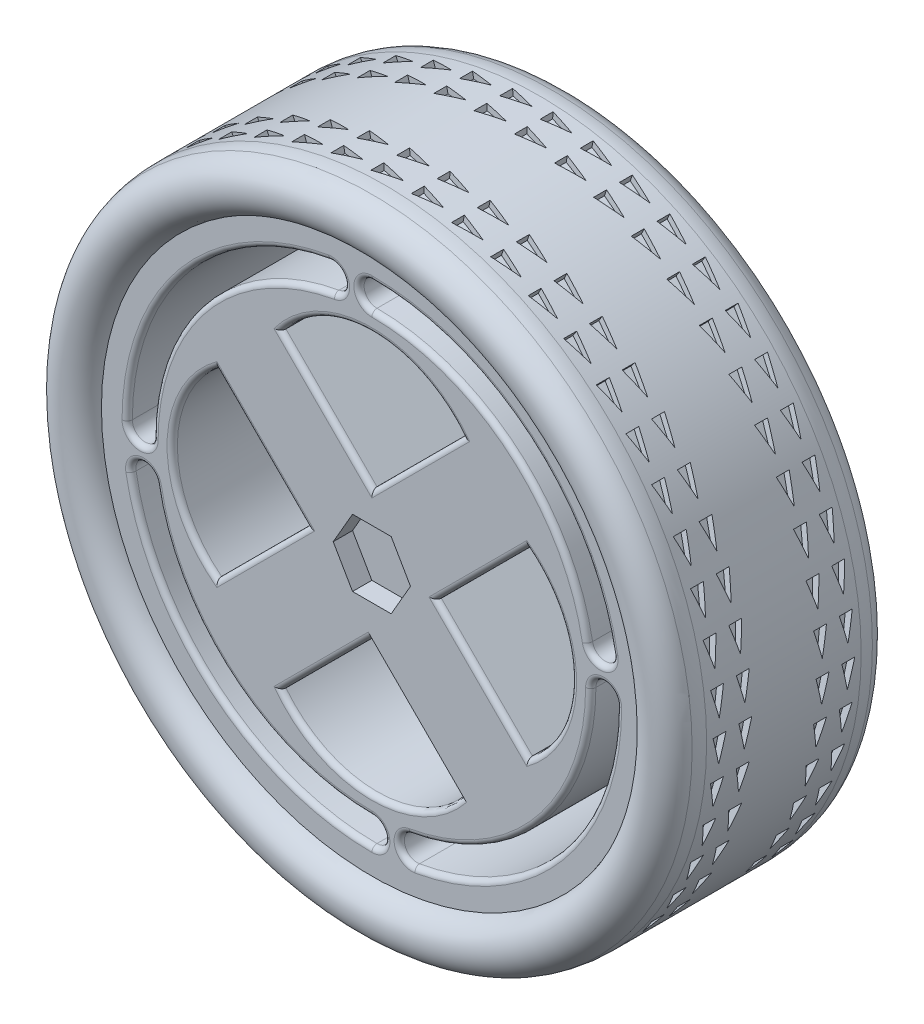
from build123d import *

# Parameters (mm, degrees)
IZIM1_R                     = 25
Y_KSEKLIK_EKSTR_ZYON1_DEPTH = 10
RADYUS3_R                   = 4
IZIM3_R                     = 1
KES_EKSTR_ZYON1_DEPTH       = 10
KES_EKSTR_ZYON2_DEPTH       = 41.620192146
IZIM5_R                     = 21
KES_EKSTR_ZYON3_DEPTH       = 3
RADYUS5_R                   = 2
RADYUS6_R                   = 2
KES_EKSTR_ZYON6_DEPTH       = 39.603756399
RADYUS7_R                   = 0.4
RADYUS8_R                   = 0.4
RADYUS9_R                   = 0.4
KES_EKSTR_ZYON7_DEPTH       = 1.5
KES_EKSTR_ZYON8_DEPTH       = 0.5
DAIRESEL_KAPLAMA1_COUNT     = 50


with BuildPart() as part:
    # Çizim1 → Yükseklik-Ekstrüzyon1 (new, symmetric)
    with BuildSketch(Plane.XY):
        Circle(IZIM1_R)
    extrude(amount=Y_KSEKLIK_EKSTR_ZYON1_DEPTH, both=True)

    # Radyus3
    radyus3_edges = [part.edges().sort_by_distance(p)[0] for p in [
        (-25, 0, -10),
        (-25, 0, 10),
    ]]
    fillet(radyus3_edges, radius=RADYUS3_R)

    # Çizim3 → Kes-Ekstrüzyon1 (cut)
    with BuildSketch(Plane(origin=(0, 0, -10), x_dir=(-1, 0, 0), z_dir=(0, 0, -1))):
        Circle(IZIM3_R)
    extrude(amount=-KES_EKSTR_ZYON1_DEPTH, mode=Mode.SUBTRACT)

    # Çizim4 → Kes-Ekstrüzyon2 (cut, through all)
    with BuildSketch(Plane.XY.offset(10)):
        with BuildLine():
            Line((0, 5), (-7.071067812, 12.071067812))
            ThreePointArc((-7.071067812, 12.071067812), (0, 15.503303449), (7.071067812, 12.071067812))
            Line((7.071067812, 12.071067812), (0, 5))
        make_face()
        with BuildLine():
            Line((5, 0), (12.071067812, 7.071067812))
            ThreePointArc((12.071067812, 7.071067812), (15.503303449, 0), (12.071067812, -7.071067812))
            Line((12.071067812, -7.071067812), (5, 0))
        make_face()
        with BuildLine():
            Line((0, -5), (7.071067812, -12.071067812))
            ThreePointArc((7.071067812, -12.071067812), (0, -15.503303449), (-7.071067812, -12.071067812))
            Line((-7.071067812, -12.071067812), (0, -5))
        make_face()
        with BuildLine():
            Line((-5, 0), (-12.071067812, -7.071067812))
            ThreePointArc((-12.071067812, -7.071067812), (-15.503303449, 0), (-12.071067812, 7.071067812))
            Line((-12.071067812, 7.071067812), (-5, 0))
        make_face()
    extrude(amount=-KES_EKSTR_ZYON2_DEPTH, mode=Mode.SUBTRACT)

    # Çizim5 → Kes-Ekstrüzyon3 (cut)
    with BuildSketch(Plane.XY.offset(10)):
        Circle(IZIM5_R)
    kes_ekstr_zyon3 = extrude(amount=-KES_EKSTR_ZYON3_DEPTH, mode=Mode.SUBTRACT)

    # Aynalama1: Kes-Ekstrüzyon3 across plane
    add(kes_ekstr_zyon3.mirror(Plane.XY), mode=Mode.SUBTRACT)

    # Radyus5
    # the kernel refuses this fillet: 2 mm, written as the material it takes off along each edge
    with BuildSketch(Plane(origin=(0, 0, 10), x_dir=(1, 0, 0), z_dir=(0, -1, 0))) as radyus5_piece_1:
        with BuildLine():
            CenterArc((22.936491673, -3.5), RADYUS5_R, 14.477512186, 151.044975628)
            Line((21, -3), (20.961270167, -2.99))
            ThreePointArc((20.961270167, -2.99), (20.96, -1.5), (20.96, 0))
            Line((20.96, 0), (21, 0.04))
            ThreePointArc((21, 0.04), (23.47398464, -0.806099563), (24.91171318, -2.99))
            Line((24.91171318, -2.99), (24.872983346, -3))
        make_face()
    revolve(axis=Axis((0, 0, 10), (0, 0, 1)), mode=Mode.SUBTRACT)

    # Radyus6
    # the kernel refuses this fillet: 2 mm, written as the material it takes off along each edge
    with BuildSketch(Plane(origin=(0, 0, -10), x_dir=(1, 0, 0), z_dir=(0, -1, 0))) as radyus6_piece_1:
        with BuildLine():
            CenterArc((22.936491673, 3.5), RADYUS6_R, 194.477512186, 151.044975628)
            Line((21, 3), (20.961270167, 2.99))
            ThreePointArc((20.961270167, 2.99), (20.96, 1.5), (20.96, 0))
            Line((20.96, 0), (21, -0.04))
            ThreePointArc((21, -0.04), (23.47398464, 0.806099563), (24.91171318, 2.99))
            Line((24.91171318, 2.99), (24.872983346, 3))
        make_face()
    revolve(axis=Axis((0, 0, -10), (0, 0, 1)), mode=Mode.SUBTRACT)

    # Çizim6 → Kes-Ekstrüzyon6 (cut, through all)
    with BuildSketch(Plane(origin=(0, 0, -7), x_dir=(-1, 0, 0), z_dir=(0, 0, -1))):
        with BuildLine():
            ThreePointArc((0, 18.999394742), (-12.212575532, 14.554380765), (-18.710751245, 3.299210274))
            ThreePointArc((-18.710751245, 3.299210274), (-17.899591669, 2.140754343), (-16.741135739, 2.951913918))
            ThreePointArc((-16.741135739, 2.951913918), (-10.927000312, 13.022291879), (0, 16.999394742))
            ThreePointArc((0, 16.999394742), (1, 17.999394742), (0, 18.999394742))
        make_face()
        with BuildLine():
            ThreePointArc((18.999394742, 0), (14.554380765, 12.212575532), (3.299210274, 18.710751245))
            ThreePointArc((3.299210274, 18.710751245), (2.140754343, 17.899591669), (2.951913918, 16.741135739))
            ThreePointArc((2.951913918, 16.741135739), (13.022291879, 10.927000312), (16.999394742, 0))
            ThreePointArc((16.999394742, 0), (17.999394742, -1), (18.999394742, 0))
        make_face()
        with BuildLine():
            ThreePointArc((0, -18.999394742), (12.212575532, -14.554380765), (18.710751245, -3.299210274))
            ThreePointArc((18.710751245, -3.299210274), (17.899591669, -2.140754343), (16.741135739, -2.951913918))
            ThreePointArc((16.741135739, -2.951913918), (10.927000312, -13.022291879), (0, -16.999394742))
            ThreePointArc((0, -16.999394742), (-1, -17.999394742), (0, -18.999394742))
        make_face()
        with BuildLine():
            ThreePointArc((-18.999394742, 0), (-14.554380765, -12.212575532), (-3.299210274, -18.710751245))
            ThreePointArc((-3.299210274, -18.710751245), (-2.140754343, -17.899591669), (-2.951913918, -16.741135739))
            ThreePointArc((-2.951913918, -16.741135739), (-13.022291879, -10.927000312), (-16.999394742, 0))
            ThreePointArc((-16.999394742, 0), (-17.999394742, 1), (-18.999394742, 0))
        make_face()
    extrude(amount=-KES_EKSTR_ZYON6_DEPTH, mode=Mode.SUBTRACT)

    # Radyus7
    radyus7_edges = [part.edges().sort_by_distance(p)[0] for p in [
        (17.999394742, 1, -7),
        (14.554380765, -12.212575532, -7),
        (2.140754343, -17.899591669, -7),
        (13.022291879, -10.927000312, -7),
        (1, -17.999394742, -7),
        (-12.212575532, -14.554380765, -7),
        (-17.899591669, -2.140754343, -7),
        (-10.927000312, -13.022291879, -7),
        (-17.999394742, -1, -7),
        (-14.554380765, 12.212575532, -7),
        (-2.140754343, 17.899591669, -7),
        (-13.022291879, 10.927000312, -7),
        (-1, 17.999394742, -7),
        (12.212575532, 14.554380765, -7),
        (17.899591669, 2.140754343, -7),
        (10.927000312, 13.022291879, -7),
    ]]
    fillet(radyus7_edges, radius=RADYUS7_R)

    # Radyus8
    radyus8_edges = [part.edges().sort_by_distance(p)[0] for p in [
        (-3.535533906, 8.535533906, -7),
        (3.535533906, 8.535533906, -7),
        (0, 15.503303449, -7),
        (-8.535533906, -3.535533906, -7),
        (-8.535533906, 3.535533906, -7),
        (-15.503303449, 0, -7),
        (8.535533906, 3.535533906, -7),
        (8.535533906, -3.535533906, -7),
        (15.503303449, 0, -7),
        (3.535533906, -8.535533906, -7),
        (-3.535533906, -8.535533906, -7),
        (0, -15.503303449, -7),
    ]]
    fillet(radyus8_edges, radius=RADYUS8_R)

    # Radyus9
    radyus9_edges = [part.edges().sort_by_distance(p)[0] for p in [
        (-17.899591669, -2.140754343, 7),
        (-10.927000312, -13.022291879, 7),
        (1, -17.999394742, 7),
        (2.140754343, -17.899591669, 7),
        (13.022291879, -10.927000312, 7),
        (17.999394742, 1, 7),
        (17.899591669, 2.140754343, 7),
        (10.927000312, 13.022291879, 7),
        (-1, 17.999394742, 7),
        (-2.140754343, 17.899591669, 7),
        (-13.022291879, 10.927000312, 7),
        (-17.999394742, -1, 7),
        (0, -15.503303449, 7),
        (3.535533906, 8.535533906, 7),
        (-3.535533906, 8.535533906, 7),
        (-8.535533906, 3.535533906, 7),
        (-15.503303449, 0, 7),
        (8.535533906, -3.535533906, 7),
        (8.535533906, 3.535533906, 7),
        (0, 15.503303449, 7),
        (15.503303449, 0, 7),
        (-3.535533906, -8.535533906, 7),
        (-8.535533906, -3.535533906, 7),
        (-12.212575532, -14.554380765, 7),
        (14.554380765, -12.212575532, 7),
        (12.212575532, 14.554380765, 7),
        (-14.554380765, 12.212575532, 7),
    ]]
    fillet(radyus9_edges, radius=RADYUS9_R)

    # Çizim7 → Kes-Ekstrüzyon7 (cut)
    with BuildSketch(Plane.XY.offset(7)):
        Polygon((3, 0), (1.5, 2.598076211), (-1.5, 2.598076211), (-3, 0), (-1.5, -2.598076211), (1.5, -2.598076211), align=None)
    extrude(amount=-KES_EKSTR_ZYON7_DEPTH, mode=Mode.SUBTRACT)

    # Çizim8 → Kes-Ekstrüzyon8 (cut)
    with BuildSketch(Plane(origin=(-25, 0, 0), x_dir=(0, 0, -1), z_dir=(1, 0, 0))):
        Polygon((3.5, 0), (3.004530205, 2), (2.5, 0), align=None)
        Polygon((5.5, 0), (4.5, 0), (4.995469795, 2), align=None)
        Polygon((-4.995469795, 2), (-5.5, 0), (-4.5, 0), align=None)
        Polygon((-2.5, 0), (-3.5, 0), (-3.004530205, 2), align=None)
    kes_ekstr_zyon8 = extrude(amount=KES_EKSTR_ZYON8_DEPTH, mode=Mode.SUBTRACT)

    # Dairesel Kaplama1: Kes-Ekstrüzyon8 ×50 about axis
    dairesel_kaplama1_axis = Axis((0, 0, 0), (0, 0, 1))
    for i in range(1, DAIRESEL_KAPLAMA1_COUNT):
        add(kes_ekstr_zyon8.rotate(dairesel_kaplama1_axis, i * 360 / DAIRESEL_KAPLAMA1_COUNT), mode=Mode.SUBTRACT)


solid = part.part
